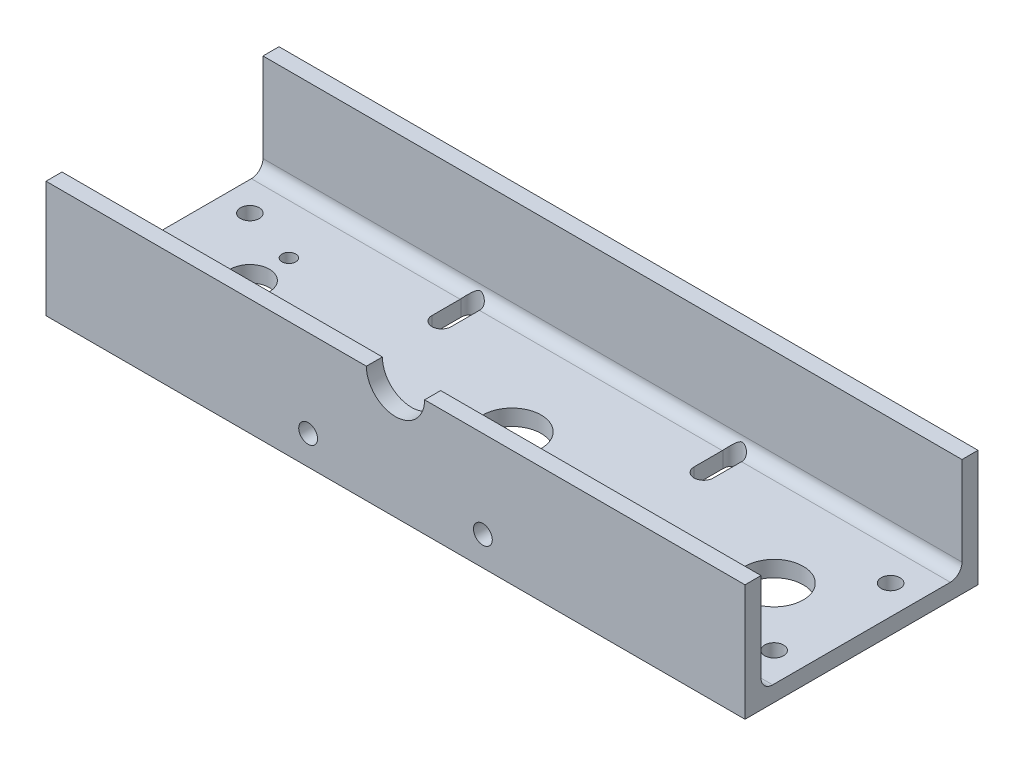
from build123d import *

# Parameters (mm, degrees)
BOSS_EXTRUDE1_DEPTH = 152.4
CUT_EXTRUDE1_DEPTH  = 9.398
SKETCH5_R           = 2.05
CUT_EXTRUDE2_DEPTH  = 9.398
SKETCH2_R           = 4.25
SKETCH2_R_2         = 6.35
SKETCH2_R_3         = 1.5
CUT_EXTRUDE3_DEPTH  = 9.398
CUT_EXTRUDE4_DEPTH  = 9.398
SKETCH7_R           = 2.05
CUT_EXTRUDE5_DEPTH  = 6.35


with BuildPart() as part:
    # Sketch1 → Boss-Extrude1 (new body)
    with BuildSketch(Plane(origin=(0, 0, 0), x_dir=(0, 0, -1), z_dir=(1, 0, 0))):
        with BuildLine():
            Line((-21.9075, -6.6675), (-21.9075, 9.2075))
            Line((-21.9075, 9.2075), (-21.9075, 12.7))
            Line((-21.9075, 12.7), (-25.4, 12.7))
            Line((-25.4, 12.7), (-25.4, -12.7))
            Line((-25.4, -12.7), (25.4, -12.7))
            Line((25.4, -12.7), (25.4, 12.7))
            Line((25.4, 12.7), (21.9075, 12.7))
            Line((21.9075, 12.7), (21.9075, 9.2075))
            Line((21.9075, 9.2075), (21.9075, -6.6675))
            ThreePointArc((21.9075, -6.6675), (21.163551224, -8.463551224), (19.3675, -9.2075))
            Line((19.3675, -9.2075), (-19.3675, -9.2075))
            ThreePointArc((-19.3675, -9.2075), (-21.163551224, -8.463551224), (-21.9075, -6.6675))
        make_face()
    extrude(amount=BOSS_EXTRUDE1_DEPTH)

    # Sketch6 → Cut-Extrude1 (cut)
    with BuildSketch(Plane.XY.offset(25.4)):
        with BuildLine():
            ThreePointArc((69.85, 12.7), (76.2, 6.35), (82.55, 12.7))
            Line((82.55, 12.7), (69.85, 12.7))
        make_face()
    extrude(amount=-CUT_EXTRUDE1_DEPTH, mode=Mode.SUBTRACT)

    # Sketch5 → Cut-Extrude2 (cut)
    with BuildSketch(Plane.XZ.offset(12.7)):
        with Locations((6.35, 12.7)):
            Circle(SKETCH5_R)
        with Locations((146.05, 12.7)):
            Circle(SKETCH5_R)
        with Locations((146.05, -12.7)):
            Circle(SKETCH5_R)
        with Locations((6.35, -12.7)):
            Circle(SKETCH5_R)
    extrude(amount=-CUT_EXTRUDE2_DEPTH, mode=Mode.SUBTRACT)

    # Sketch2 → Cut-Extrude3 (cut)
    with BuildSketch(Plane.XZ.offset(12.7)):
        with Locations((19.05, 0)):
            Circle(SKETCH2_R)
        with Locations((133.35, 0)):
            Circle(SKETCH2_R_2)
        with Locations((19.05, 8.5)):
            Circle(SKETCH2_R_3)
        with Locations((19.05, -8.5)):
            Circle(SKETCH2_R_3)
        with Locations((76.2, 0)):
            Circle(SKETCH2_R_2)
    extrude(amount=-CUT_EXTRUDE3_DEPTH, mode=Mode.SUBTRACT)

    # Sketch3 → Cut-Extrude4 (cut)
    with BuildSketch(Plane.XZ.offset(12.7)):
        with BuildLine():
            ThreePointArc((49.725, 19.572413762), (47.625, 21.672413762), (45.525, 19.572413762))
            Line((45.525, 19.572413762), (45.525, 13.222413762))
            ThreePointArc((45.525, 13.222413762), (47.625, 11.122413762), (49.725, 13.222413762))
            Line((49.725, 13.222413762), (49.725, 19.572413762))
        make_face()
        with BuildLine():
            ThreePointArc((45.525, -19.572413762), (47.625, -21.672413762), (49.725, -19.572413762))
            Line((49.725, -19.572413762), (49.725, -13.222413762))
            ThreePointArc((49.725, -13.222413762), (47.625, -11.122413762), (45.525, -13.222413762))
            Line((45.525, -13.222413762), (45.525, -19.572413762))
        make_face()
        with BuildLine():
            Line((102.675, -13.222413762), (102.675, -19.572413762))
            ThreePointArc((102.675, -19.572413762), (104.775, -21.672413762), (106.875, -19.572413762))
            Line((106.875, -19.572413762), (106.875, -13.222413762))
            ThreePointArc((106.875, -13.222413762), (104.775, -11.122413762), (102.675, -13.222413762))
        make_face()
        with BuildLine():
            ThreePointArc((106.875, 19.572413762), (104.775, 21.672413762), (102.675, 19.572413762))
            Line((102.675, 19.572413762), (102.675, 13.222413762))
            ThreePointArc((102.675, 13.222413762), (104.775, 11.122413762), (106.875, 13.222413762))
            Line((106.875, 13.222413762), (106.875, 19.572413762))
        make_face()
    extrude(amount=-CUT_EXTRUDE4_DEPTH, mode=Mode.SUBTRACT)

    # Sketch7 → Cut-Extrude5 (cut)
    with BuildSketch(Plane.XY.offset(25.4)):
        with Locations((95.25, -6.35)):
            Circle(SKETCH7_R)
        with Locations((57.15, -6.35)):
            Circle(SKETCH7_R)
    extrude(amount=-CUT_EXTRUDE5_DEPTH, mode=Mode.SUBTRACT)


solid = part.part
